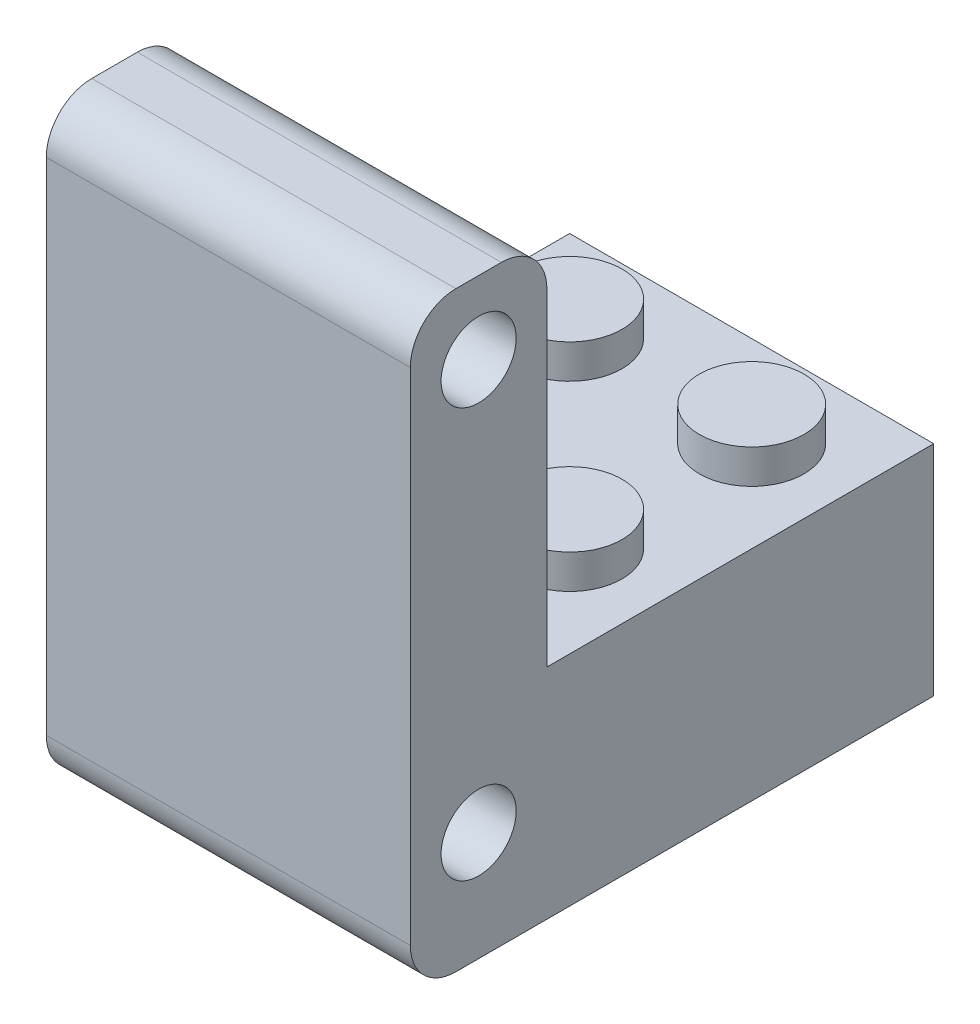
from build123d import *

# Parameters (mm, degrees)
SKETCH1_R           = 1.65
BOSS_EXTRUDE1_DEPTH = 16
SKETCH2_R           = 2.3
BOSS_EXTRUDE2_DEPTH = 1.5
FILLET1_R           = 2


with BuildPart() as part:
    # Sketch1 → Boss-Extrude1 (new body)
    with BuildSketch(Plane(origin=(76, 0, 0), x_dir=(0, 0, -1), z_dir=(1, 0, 0))):
        Polygon((-39.367141304, -29.396728555), (-62.367141304, -29.396728555), (-62.367141304, -3.396728555), (-56.367141304, -3.396728555), (-56.367141304, -19.796728555), (-39.367141304, -19.796728555), align=None)
        with Locations((-59.367141305, -24.59672823)):
            Circle(SKETCH1_R, mode=Mode.SUBTRACT)
        with Locations((-59.367141305, -6.59672823)):
            Circle(SKETCH1_R, mode=Mode.SUBTRACT)
    extrude(amount=-BOSS_EXTRUDE1_DEPTH)

    # Sketch2 → Boss-Extrude2 (add)
    with BuildSketch(Plane(origin=(0, -19.796728555, 0), x_dir=(1, 0, 0), z_dir=(0, 1, 0))):
        with Locations((64, -43.367141304)):
            Circle(SKETCH2_R)
        with Locations((72, -43.367141304)):
            Circle(SKETCH2_R)
        with Locations((72, -51.367141304)):
            Circle(SKETCH2_R)
        with Locations((64, -51.367141304)):
            Circle(SKETCH2_R)
    extrude(amount=BOSS_EXTRUDE2_DEPTH)

    # Fillet1
    fillet1_edges = [part.edges().sort_by_distance(p)[0] for p in [
        (68, -29.396728555, 62.367141304),
        (68, -3.396728555, 62.367141304),
        (68, -3.396728555, 56.367141304),
    ]]
    fillet(fillet1_edges, radius=FILLET1_R)


solid = part.part
